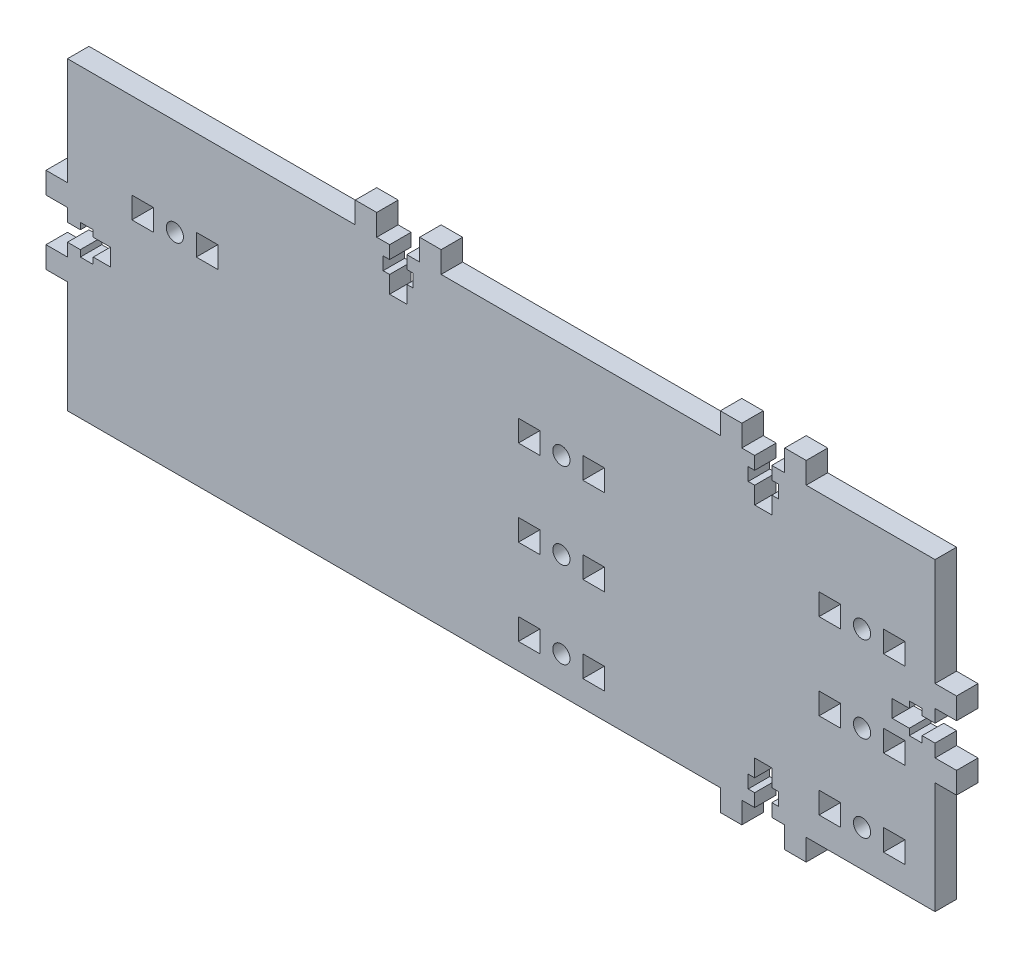
from build123d import *

# Parameters (mm, degrees)
ESQUISSE1_W        = 5
ESQUISSE1_H        = 5
ESQUISSE1_R        = 2
BOSS_EXTRU_1_DEPTH = 5


with BuildPart() as part:
    # Esquisse1 → Boss.-Extru.1 (new body)
    with BuildSketch(Plane.XY):
        Polygon((-48, 22.5), (-115, 22.5), (-115, -2.5), (-120, -2.5), (-120, -7.5), (-115, -7.5), (-115, -10.5), (-112, -10.5), (-112, -9), (-109, -9), (-109, -10.5), (-105, -10.5), (-105, -14.5), (-109, -14.5), (-109, -16), (-112, -16), (-112, -14.5), (-115, -14.5), (-115, -17.5), (-120, -17.5), (-120, -22.5), (-115, -22.5), (-115, -48.5), (37, -48.5), (37, -53.5), (42, -53.5), (42, -48.5), (45, -48.5), (45, -45.5), (43.5, -45.5), (43.5, -42.5), (45, -42.5), (45, -38.5), (49, -38.5), (49, -42.5), (50.5, -42.5), (50.5, -45.5), (49, -45.5), (49, -48.5), (52, -48.5), (52, -53.5), (57, -53.5), (57, -48.5), (87, -48.5), (87, -22.5), (92, -22.5), (92, -17.5), (87, -17.5), (87, -14.5), (84, -14.5), (84, -16), (81, -16), (81, -14.5), (77, -14.5), (77, -10.5), (81, -10.5), (81, -9), (84, -9), (84, -10.5), (87, -10.5), (87, -7.5), (92, -7.5), (92, -2.5), (87, -2.5), (87, 22.5), (57, 22.5), (57, 27.5), (52, 27.5), (52, 22.5), (49, 22.5), (49, 19.5), (50.5, 19.5), (50.5, 16.5), (49, 16.5), (49, 12.5), (45, 12.5), (45, 16.5), (43.5, 16.5), (43.5, 19.5), (45, 19.5), (45, 22.5), (42, 22.5), (42, 27.5), (37, 27.5), (37, 22.5), (-28, 22.5), (-28, 27.5), (-33, 27.5), (-33, 22.5), (-36, 22.5), (-36, 19.5), (-34.5, 19.5), (-34.5, 16.5), (-36, 16.5), (-36, 12.5), (-40, 12.5), (-40, 16.5), (-41.5, 16.5), (-41.5, 19.5), (-40, 19.5), (-40, 22.5), (-43, 22.5), (-43, 27.5), (-48, 27.5), align=None)
        with Locations((-7.5, -40)):
            Rectangle(ESQUISSE1_W, ESQUISSE1_H, mode=Mode.SUBTRACT)
        with Locations((0, -40)):
            Circle(ESQUISSE1_R, mode=Mode.SUBTRACT)
        with Locations((7.5, -40)):
            Rectangle(ESQUISSE1_W, ESQUISSE1_H, mode=Mode.SUBTRACT)
        with Locations((62.5, -40)):
            Rectangle(ESQUISSE1_W, ESQUISSE1_H, mode=Mode.SUBTRACT)
        with Locations((70, -40)):
            Circle(ESQUISSE1_R, mode=Mode.SUBTRACT)
        with Locations((77.5, -40)):
            Rectangle(ESQUISSE1_W, ESQUISSE1_H, mode=Mode.SUBTRACT)
        with Locations((-7.5, -20)):
            Rectangle(ESQUISSE1_W, ESQUISSE1_H, mode=Mode.SUBTRACT)
        with Locations((0, -20)):
            Circle(ESQUISSE1_R, mode=Mode.SUBTRACT)
        with Locations((7.5, -20)):
            Rectangle(ESQUISSE1_W, ESQUISSE1_H, mode=Mode.SUBTRACT)
        with Locations((62.5, -20)):
            Rectangle(ESQUISSE1_W, ESQUISSE1_H, mode=Mode.SUBTRACT)
        with Locations((70, -20)):
            Circle(ESQUISSE1_R, mode=Mode.SUBTRACT)
        with Locations((77.5, -20)):
            Rectangle(ESQUISSE1_W, ESQUISSE1_H, mode=Mode.SUBTRACT)
        with Locations((-97.5, 0)):
            Rectangle(ESQUISSE1_W, ESQUISSE1_H, mode=Mode.SUBTRACT)
        with Locations((-90, 0)):
            Circle(ESQUISSE1_R, mode=Mode.SUBTRACT)
        with Locations((-82.5, 0)):
            Rectangle(ESQUISSE1_W, ESQUISSE1_H, mode=Mode.SUBTRACT)
        with Locations((-7.5, 0)):
            Rectangle(ESQUISSE1_W, ESQUISSE1_H, mode=Mode.SUBTRACT)
        Circle(ESQUISSE1_R, mode=Mode.SUBTRACT)
        with Locations((7.5, 0)):
            Rectangle(ESQUISSE1_W, ESQUISSE1_H, mode=Mode.SUBTRACT)
        with Locations((62.5, 0)):
            Rectangle(ESQUISSE1_W, ESQUISSE1_H, mode=Mode.SUBTRACT)
        with Locations((70, 0)):
            Circle(ESQUISSE1_R, mode=Mode.SUBTRACT)
        with Locations((77.5, 0)):
            Rectangle(ESQUISSE1_W, ESQUISSE1_H, mode=Mode.SUBTRACT)
    extrude(amount=BOSS_EXTRU_1_DEPTH)


solid = part.part
